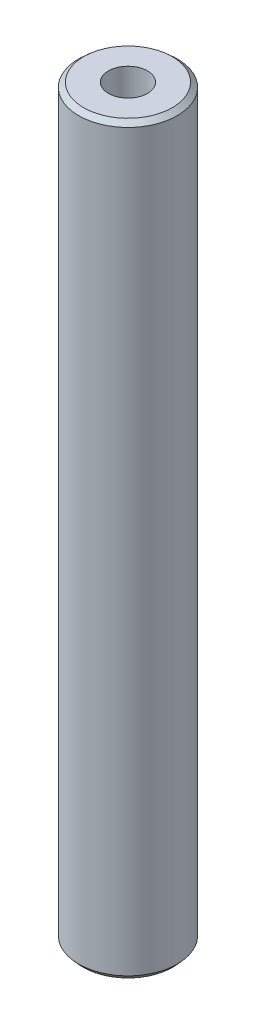
from build123d import *
from OCP.BRepFilletAPI import BRepFilletAPI_MakeChamfer

# Parameters (mm, degrees)
SKETCH1_R           = 30
BOSS_EXTRUDE1_DEPTH = 453.148733107
SKETCH2_R           = 11.89840085
CUT_EXTRUDE1_DEPTH  = 456.130502511
CHAMFER1_SIZE       = 2.700661286
CHAMFER1_SIZE2      = 3.03761385


with BuildPart() as part:
    # Sketch1 → Boss-Extrude1 (new body)
    with BuildSketch(Plane(origin=(0, 0, 0), x_dir=(1, 0, 0), z_dir=(0, 1, 0))):
        Circle(SKETCH1_R)
    extrude(amount=BOSS_EXTRUDE1_DEPTH)

    # Sketch2 → Cut-Extrude1 (cut, through all)
    with BuildSketch(Plane(origin=(0, 0, 0), x_dir=(1, 0, 0), z_dir=(0, 1, 0))):
        Circle(SKETCH2_R)
    extrude(amount=CUT_EXTRUDE1_DEPTH, mode=Mode.SUBTRACT)

    # Chamfer1: one chamfer whose edges measure the first distance from different faces: ONE call of the kernel's chamfer builder (chamfer() names one face for all edges)
    chamfer1_edges_1 = [part.edges().sort_by_distance(p)[0] for p in [
        (-30, 453.148733107, 0),
    ]]
    chamfer1_side_1 = [part.faces().sort_by_distance(p)[0] for p in [
        (-30, 226.574366553, 0),
    ]]
    chamfer1_edges_2 = [part.edges().sort_by_distance(p)[0] for p in [
        (-30, 0, 0),
    ]]
    chamfer1_side_2 = [part.faces().sort_by_distance(p)[0] for p in [
        (-29.151471863, 0, 0),
    ]]
    chamfer1 = BRepFilletAPI_MakeChamfer(part.part.solid().wrapped)
    for e in chamfer1_edges_1:
        chamfer1.Add(CHAMFER1_SIZE, CHAMFER1_SIZE2, e.wrapped, chamfer1_side_1[0].wrapped)  # the first distance lies on this face
    for e in chamfer1_edges_2:
        chamfer1.Add(CHAMFER1_SIZE, CHAMFER1_SIZE2, e.wrapped, chamfer1_side_2[0].wrapped)  # the first distance lies on this face
    add(Compound.cast(chamfer1.Shape()), mode=Mode.REPLACE)


solid = part.part
